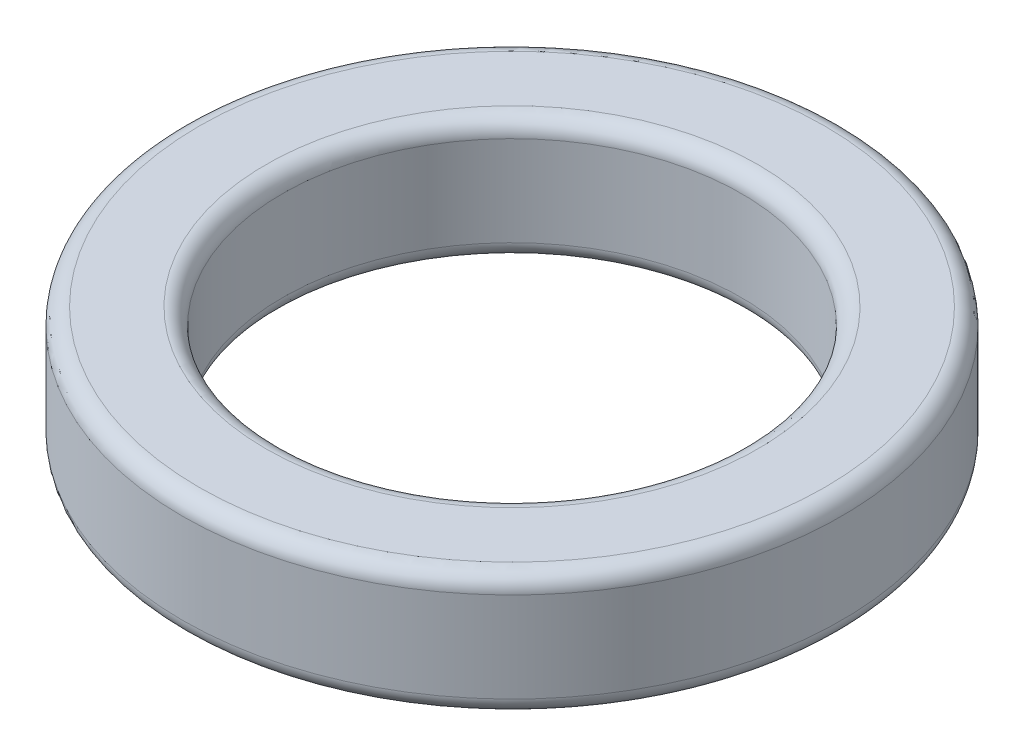
from build123d import *

# Parameters (mm, degrees)
SKETCH1_R                = 3.95
BOSS_EXTRUDE1_DEPTH      = 1.48
M5_CLEARANCE_HOLE1_D     = 5.5
M5_CLEARANCE_HOLE1_DEPTH = 1.48
M5_CLEARANCE_HOLE1_TIP   = 1.652366702
FILLET1_R                = 0.2


with BuildPart() as part:
    # Sketch1 → Boss-Extrude1 (new body)
    with BuildSketch(Plane(origin=(0, 0, 0), x_dir=(1, 0, 0), z_dir=(0, 1, 0))):
        Circle(SKETCH1_R)
    extrude(amount=BOSS_EXTRUDE1_DEPTH)

    # M5 Clearance Hole1
    with Locations(Plane(origin=(0, 1.48, 0), x_dir=(1, 0, 0), z_dir=(0, 1, 0))):
        with Locations((0, 0)):
            Hole(M5_CLEARANCE_HOLE1_D / 2, depth=M5_CLEARANCE_HOLE1_DEPTH)
            with Locations((0, 0, -(M5_CLEARANCE_HOLE1_DEPTH + M5_CLEARANCE_HOLE1_TIP / 2))):  # 118° drill point
                Cone(0, M5_CLEARANCE_HOLE1_D / 2, M5_CLEARANCE_HOLE1_TIP, mode=Mode.SUBTRACT)

    # Fillet1
    fillet1_edges = [part.edges().sort_by_distance(p)[0] for p in [
        (2.75, 0, 0),
        (-3.95, 0, 0),
        (-3.95, 1.48, 0),
        (2.75, 1.48, 0),
    ]]
    fillet(fillet1_edges, radius=FILLET1_R)


solid = part.part
